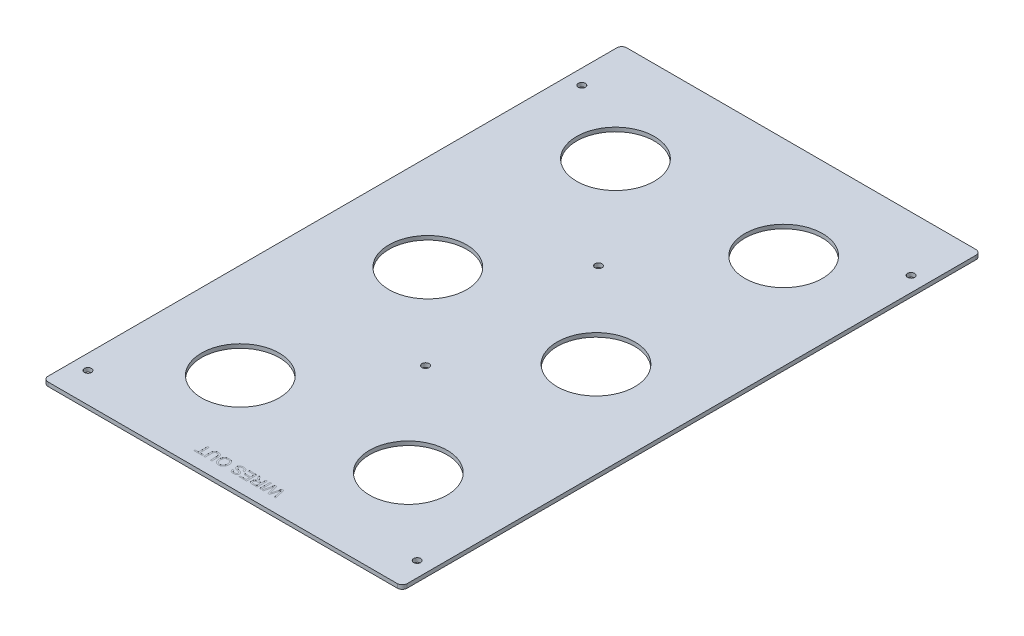
from build123d import *

# Parameters (mm, degrees)
SKETCH1_R             = 24.727
BOSS_EXTRUDE1_DEPTH   = 2.54
SKETCH2_W             = 0.941716851
SKETCH2_H             = 6.677628581
CUT_EXTRUDE2_DEPTH    = 0.0254
F_8_CLEARANCE_HOLE1_D = 4.4958


with BuildPart() as part:
    # Sketch1 → Boss-Extrude1 (new body)
    with BuildSketch(Plane(origin=(0, 0, 0), x_dir=(1, 0, 0), z_dir=(0, 1, 0))):
        with BuildLine():
            Line((-111.125, 184.15), (111.125, 184.15))
            ThreePointArc((111.125, 184.15), (113.37006403, 183.22006403), (114.3, 180.975))
            Line((114.3, 180.975), (114.3, -180.975))
            ThreePointArc((114.3, -180.975), (113.37006403, -183.22006403), (111.125, -184.15))
            Line((111.125, -184.15), (-111.125, -184.15))
            ThreePointArc((-111.125, -184.15), (-113.37006403, -183.22006403), (-114.3, -180.975))
            Line((-114.3, -180.975), (-114.3, 180.975))
            ThreePointArc((-114.3, 180.975), (-113.37006403, 183.22006403), (-111.125, 184.15))
        make_face()
        with Locations((53.5178, -119.508581684)):
            Circle(SKETCH1_R, mode=Mode.SUBTRACT)
        with Locations((53.5178, -0.064290842)):
            Circle(SKETCH1_R, mode=Mode.SUBTRACT)
        with Locations((-53.5178, -119.38)):
            Circle(SKETCH1_R, mode=Mode.SUBTRACT)
        with Locations((-53.5178, -0.064290842)):
            Circle(SKETCH1_R, mode=Mode.SUBTRACT)
        with Locations((-53.5178, 119.38)):
            Circle(SKETCH1_R, mode=Mode.SUBTRACT)
        with Locations((53.5178, 119.38)):
            Circle(SKETCH1_R, mode=Mode.SUBTRACT)
    extrude(amount=BOSS_EXTRUDE1_DEPTH)

    # Sketch2 → Cut-Extrude2 (cut)
    # profile 1 of 8: a face of its own
    with BuildSketch(Plane(origin=(0, 2.54, 0), x_dir=(1, 0, 0), z_dir=(0, 1, 0))):
        with BuildLine():
            Line((23.632943238, -168.91), (25.314389377, -175.587628581))
            Line((25.314389377, -175.587628581), (24.341906208, -175.587628581))
            Line((24.341906208, -175.587628581), (23.350695716, -171.196071163))
            add(Edge.make_bspline(
                [(23.350695716, -171.196071163), (23.299325023, -170.969580808), (23.19710809, -170.518912379), (23.096001693, -170.067993508), (23.045707872, -169.843690855)],
                knots=[0, 0, 0, 0, 1.00513078, 2, 2, 2, 2], degree=3))
            add(Edge.make_bspline(
                [(23.045707872, -169.843690855), (23.021895326, -169.924344538), (22.976941578, -170.076603994), (22.916172822, -170.292446444), (22.860978508, -170.480827734), (22.813955785, -170.642626067), (22.775881668, -170.778068762), (22.743008908, -170.885491505), (22.720603246, -170.966997983), (22.70732561, -171.011932775), (22.701927715, -171.030200581)],
                knots=[0, 0, 0, 0, 1.633809233, 3.084334118, 4.356383392, 5.447555203, 6.357852567, 7.089694452, 7.629924063, 8, 8, 8, 8], degree=3))
            Line((22.701927715, -171.030200581), (21.382989057, -175.587628581))
            Line((21.382989057, -175.587628581), (20.24998597, -175.587628581))
            Line((20.24998597, -175.587628581), (19.296230125, -172.24212596))
            add(Edge.make_bspline(
                [(19.296230125, -172.24212596), (19.243596084, -172.03545393), (19.139813145, -171.627941413), (19.001920759, -171.020936424), (18.874650495, -170.428657498), (18.801340432, -170.036929476), (18.765176731, -169.843690855)],
                knots=[0, 0, 0, 0, 1.04154457, 2.053700482, 3.039894486, 4, 4, 4, 4], degree=3))
            add(Edge.make_bspline(
                [(18.765176731, -169.843690855), (18.742796194, -169.942212876), (18.695517606, -170.150339344), (18.622811501, -170.478808574), (18.540293141, -170.839224554), (18.484149649, -171.09036912), (18.454838223, -171.221486816)],
                knots=[0, 0, 0, 0, 0.858436457, 1.813435672, 2.858437265, 4, 4, 4, 4], degree=3))
            Line((18.454838223, -171.221486816), (17.468978394, -175.587628581))
            Line((17.468978394, -175.587628581), (16.496495226, -175.587628581))
            Line((16.496495226, -175.587628581), (18.179279031, -168.91))
            Line((18.179279031, -168.91), (19.214632501, -168.91))
            Line((19.214632501, -168.91), (20.609818119, -174.01319572))
            add(Edge.make_bspline(
                [(20.609818119, -174.01319572), (20.623827793, -174.063084201), (20.650440955, -174.157853738), (20.685324579, -174.29309308), (20.719917615, -174.412030516), (20.747432964, -174.516203119), (20.771245195, -174.604561153), (20.792331944, -174.676845919), (20.805894374, -174.734472146), (20.815702094, -174.76722518), (20.819831679, -174.781015994)],
                knots=[0, 0, 0, 0, 1.562239628, 2.967673567, 4.210417925, 5.296319877, 6.215971374, 6.969386481, 7.566055473, 8, 8, 8, 8], degree=3))
            add(Edge.make_bspline(
                [(20.819831679, -174.781015994), (20.844657297, -174.693580195), (20.891682413, -174.527957792), (20.960166786, -174.295091919), (21.019046174, -174.090752029), (21.055687775, -173.96458835), (21.072650549, -173.906182442)],
                knots=[0, 0, 0, 0, 1.197732026, 2.268764715, 3.198546125, 4, 4, 4, 4], degree=3))
            Line((21.072650549, -173.906182442), (22.518667475, -168.91))
            Line((22.518667475, -168.91), (23.632943238, -168.91))
        make_face()
    # profile 2 of 8: a face of its own
    with BuildSketch(Plane(origin=(0, 2.54, 0), x_dir=(1, 0, 0), z_dir=(0, 1, 0))):
        with Locations((15.340751818, -172.248814291)):
            Rectangle(SKETCH2_W, SKETCH2_H)
    # profile 3 of 8: a face of its own
    with BuildSketch(Plane(origin=(0, 2.54, 0), x_dir=(1, 0, 0), z_dir=(0, 1, 0))):
        with BuildLine():
            Line((13.328902181, -168.91), (13.328902181, -175.587628581))
            Line((13.328902181, -175.587628581), (10.431517665, -175.587628581))
            add(Edge.make_bspline(
                [(10.431517665, -175.587628581), (10.363292806, -175.587096546), (10.231251578, -175.586066856), (10.03976983, -175.578708935), (9.861463117, -175.563077027), (9.695207674, -175.545618097), (9.541287988, -175.519839646), (9.399630705, -175.489596873), (9.270779114, -175.453853433), (9.153752793, -175.411603204), (9.045169062, -175.363819062), (8.944548789, -175.304828573), (8.847571535, -175.240298913), (8.758103027, -175.163854788), (8.672113635, -175.08172384), (8.593203482, -174.989796624), (8.519037225, -174.890373993), (8.428860855, -174.746400185), (8.334151114, -174.553413553), (8.252576009, -174.308226002), (8.200705014, -174.05148519), (8.195105726, -173.876110271), (8.192264811, -173.787130169)],
                knots=[0, 0, 0, 0, 1.242075696, 2.40389213, 3.487198984, 4.500157661, 5.446319301, 6.326791195, 7.136300648, 7.878370406, 8.590488565, 9.292260633, 9.999224673, 10.708050372, 11.431369221, 12.162165018, 12.910600795, 13.687589445, 15.252257874, 16.810406251, 18.381693487, 20, 20, 20, 20], degree=3))
            add(Edge.make_bspline(
                [(8.192264811, -173.787130169), (8.193571517, -173.730008672), (8.19615235, -173.617189797), (8.215921505, -173.45131567), (8.251692958, -173.292830312), (8.297560289, -173.14034246), (8.360348032, -172.996024572), (8.433051662, -172.856884453), (8.523248176, -172.726910071), (8.623957418, -172.601757556), (8.741064038, -172.487074803), (8.871326311, -172.381080347), (9.018660448, -172.290119283), (9.178234156, -172.205586967), (9.354159906, -172.136163929), (9.54378457, -172.075034695), (9.748575738, -172.02790233), (9.890519546, -172.004161241), (9.963334571, -171.991982422)],
                knots=[0, 0, 0, 0, 0.982645791, 1.940792824, 2.867691729, 3.775150443, 4.675643875, 5.571354211, 6.471357401, 7.392684514, 8.331098131, 9.285922955, 10.275520706, 11.304845665, 12.388884831, 13.524255008, 14.729980297, 16, 16, 16, 16], degree=3))
            add(Edge.make_bspline(
                [(9.963334571, -171.991982422), (9.909404212, -171.965100634), (9.80713011, -171.914121729), (9.667956952, -171.829773388), (9.546035076, -171.750366643), (9.476778417, -171.69082278), (9.44432017, -171.66291659)],
                knots=[0, 0, 0, 0, 1.172551213, 2.223638478, 3.167479604, 4, 4, 4, 4], degree=3))
            add(Edge.make_bspline(
                [(9.44432017, -171.66291659), (9.381132019, -171.601164157), (9.251543527, -171.474520084), (9.074703105, -171.256807636), (8.899721615, -171.017386254), (8.794666383, -170.842915484), (8.740707864, -170.753303723)],
                knots=[0, 0, 0, 0, 0.918170575, 1.883016652, 2.912673989, 4, 4, 4, 4], degree=3))
            Line((8.740707864, -170.753303723), (7.645159425, -168.91))
            Line((7.645159425, -168.91), (8.724655872, -168.91))
            Line((8.724655872, -168.91), (9.556684113, -170.319899945))
            add(Edge.make_bspline(
                [(9.556684113, -170.319899945), (9.586601501, -170.369366751), (9.644576487, -170.465225299), (9.728289267, -170.605242248), (9.810477346, -170.734077121), (9.886334988, -170.85574056), (9.960672974, -170.96702405), (10.027312005, -171.072139162), (10.094234973, -171.165131078), (10.171077393, -171.276850283), (10.264921144, -171.397638948), (10.374430167, -171.52172404), (10.475116427, -171.624510619), (10.602349215, -171.722582681), (10.760556516, -171.812377229), (10.893947832, -171.85497336), (10.958558061, -171.875605481)],
                knots=[0, 0, 0, 0, 1.130591283, 2.190900266, 3.190104209, 4.119071823, 4.994606968, 5.807262858, 6.55236009, 7.234593472, 8.459046683, 9.540234366, 10.471327768, 11.266723835, 12.676093724, 14, 14, 14, 14], degree=3))
            add(Edge.make_bspline(
                [(10.958558061, -171.875605481), (10.985700699, -171.880500221), (11.047668153, -171.891675059), (11.152888735, -171.898973364), (11.28037638, -171.906719538), (11.372768849, -171.90649384), (11.422728157, -171.906371799)],
                knots=[0, 0, 0, 0, 0.709978628, 1.620902492, 2.713552433, 4, 4, 4, 4], degree=3))
            Line((11.422728157, -171.906371799), (12.38718533, -171.906371799))
            Line((12.38718533, -171.906371799), (12.38718533, -168.91))
            Line((12.38718533, -168.91), (13.328902181, -168.91))
        make_face()
        with BuildLine():
            Line((12.38718533, -172.676867405), (10.598725912, -172.676867405))
            add(Edge.make_bspline(
                [(10.598725912, -172.676867405), (10.509041729, -172.678258399), (10.341385561, -172.680858734), (10.10700453, -172.703403287), (9.906514669, -172.738643655), (9.737355011, -172.792167838), (9.595192811, -172.86384728), (9.4719805, -172.951504301), (9.368380463, -173.060253453), (9.28317838, -173.184950494), (9.216573602, -173.320844399), (9.170033561, -173.464671415), (9.138788207, -173.613673587), (9.135593421, -173.715629033), (9.133981662, -173.76706518)],
                knots=[0, 0, 0, 0, 1.546056516, 2.890207646, 4.055830773, 5.050253158, 5.937355789, 6.790906573, 7.644595853, 8.512568064, 9.38593768, 10.244184789, 11.114197691, 12, 12, 12, 12], degree=3))
            add(Edge.make_bspline(
                [(9.133981662, -173.76706518), (9.135218998, -173.804549755), (9.137642576, -173.877971028), (9.150482994, -173.985697904), (9.174913004, -174.087786542), (9.208647521, -174.184972845), (9.251360342, -174.27746782), (9.303847642, -174.364907678), (9.36583859, -174.446845812), (9.436949475, -174.523685608), (9.518568997, -174.593612923), (9.611805656, -174.653942185), (9.715914915, -174.705209834), (9.83102038, -174.745899051), (9.956758704, -174.778443865), (10.093845904, -174.800094864), (10.241654987, -174.815761459), (10.344078112, -174.816667262), (10.396738349, -174.817132975)],
                knots=[0, 0, 0, 0, 0.965235723, 1.89061323, 2.787065514, 3.661873922, 4.534873316, 5.404925039, 6.281839248, 7.175200054, 8.095223355, 9.040740021, 10.02630299, 11.075573487, 12.177989335, 13.364883635, 14.645170704, 16, 16, 16, 16], degree=3))
            Line((10.396738349, -174.817132975), (12.38718533, -174.817132975))
            Line((12.38718533, -174.817132975), (12.38718533, -172.676867405))
        make_face(mode=Mode.SUBTRACT)
    # profile 4 of 8: a face of its own
    with BuildSketch(Plane(origin=(0, 2.54, 0), x_dir=(1, 0, 0), z_dir=(0, 1, 0))):
        Polygon((6.6512736, -168.91), (6.6512736, -175.587628581), (1.942689345, -175.587628581), (1.942689345, -174.817132975), (5.709556749, -174.817132975), (5.709556749, -172.762478027), (2.199521213, -172.762478027), (2.199521213, -171.991982422), (5.709556749, -171.991982422), (5.709556749, -169.680495605), (1.771468099, -169.680495605), (1.771468099, -168.91), align=None)
    # profile 5 of 8: a face of its own
    with BuildSketch(Plane(origin=(0, 2.54, 0), x_dir=(1, 0, 0), z_dir=(0, 1, 0))):
        with BuildLine():
            Line((0.829751248, -171.221486816), (-0.111965603, -171.221486816))
            add(Edge.make_bspline(
                [(-0.111965603, -171.221486816), (-0.122300306, -171.136920767), (-0.142153826, -170.974464831), (-0.198105729, -170.744412505), (-0.268592025, -170.537033889), (-0.361338467, -170.352541821), (-0.475255133, -170.186545829), (-0.617782751, -170.039543528), (-0.788933822, -169.910501137), (-0.984673261, -169.800161916), (-1.198851792, -169.707216884), (-1.429578835, -169.642014332), (-1.673439367, -169.602475454), (-1.840524353, -169.597450703), (-1.925840675, -169.594884983)],
                knots=[0, 0, 0, 0, 1.125761249, 2.162647979, 3.12492346, 4.01623828, 4.884793378, 5.777219259, 6.711258599, 7.709587174, 8.742442187, 9.791331093, 10.872217593, 12, 12, 12, 12], degree=3))
            add(Edge.make_bspline(
                [(-1.925840675, -169.594884983), (-2.00132428, -169.596288662), (-2.148061054, -169.599017353), (-2.361175224, -169.631583172), (-2.561144255, -169.679761442), (-2.745807794, -169.749052862), (-2.911454681, -169.836152826), (-3.058487465, -169.935607161), (-3.180435603, -170.054131077), (-3.279079502, -170.185129954), (-3.35563269, -170.324239119), (-3.409002883, -170.467751543), (-3.444935193, -170.612872597), (-3.448840901, -170.711184835), (-3.450779894, -170.759992053)],
                knots=[0, 0, 0, 0, 1.267544124, 2.464049433, 3.614542348, 4.719673496, 5.768837234, 6.754183997, 7.692231426, 8.612479311, 9.501217876, 10.350240008, 11.180974857, 12, 12, 12, 12], degree=3))
            add(Edge.make_bspline(
                [(-3.450779894, -170.759992053), (-3.448734217, -170.808320403), (-3.444731839, -170.90287513), (-3.41298182, -171.039749764), (-3.361676939, -171.167107787), (-3.289708786, -171.286035669), (-3.191897669, -171.39581424), (-3.065416139, -171.493264907), (-2.913787566, -171.585956174), (-2.799626619, -171.635388546), (-2.739141591, -171.661578924)],
                knots=[0, 0, 0, 0, 0.942081658, 1.843188798, 2.725198023, 3.611401405, 4.541884661, 5.575766242, 6.715586633, 8, 8, 8, 8], degree=3))
            add(Edge.make_bspline(
                [(-2.739141591, -171.661578924), (-2.715616019, -171.671233178), (-2.662467478, -171.693043891), (-2.571372485, -171.721914532), (-2.463281361, -171.75926362), (-2.335982467, -171.797529049), (-2.189343903, -171.83852873), (-2.02471077, -171.885712807), (-1.840776969, -171.934847595), (-1.643984004, -171.986863987), (-1.444785638, -172.039623623), (-1.254502177, -172.093569336), (-1.078352587, -172.144734389), (-0.917007378, -172.197320494), (-0.770312038, -172.249221233), (-0.637865794, -172.300101227), (-0.519433039, -172.34869434), (-0.447100591, -172.384431007), (-0.412940449, -172.401308212)],
                knots=[0, 0, 0, 0, 0.499208779, 1.12780332, 1.87546358, 2.745246929, 3.737578632, 4.865834649, 6.108484299, 7.476352792, 8.863398792, 10.155242256, 11.360521946, 12.465428895, 13.487415091, 14.415997097, 15.251929613, 16, 16, 16, 16], degree=3))
            add(Edge.make_bspline(
                [(-0.412940449, -172.401308212), (-0.33439709, -172.443817677), (-0.182787966, -172.525872006), (0.022051427, -172.671714273), (0.19175084, -172.836704186), (0.331696087, -173.014473096), (0.439742994, -173.205942272), (0.516080243, -173.409014609), (0.565656107, -173.622897826), (0.570471317, -173.769909024), (0.572919379, -173.844649807)],
                knots=[0, 0, 0, 0, 1.158956011, 2.237086722, 3.252429106, 4.221720014, 5.165272549, 6.094237939, 7.031106807, 8, 8, 8, 8], degree=3))
            add(Edge.make_bspline(
                [(0.572919379, -173.844649807), (0.5697455, -173.927437968), (0.563432677, -174.092103021), (0.507294577, -174.333691375), (0.417883054, -174.56692136), (0.314888491, -174.751512006), (0.215916434, -174.891668806), (0.132735448, -174.991049213), (0.04094839, -175.083472006), (-0.057437483, -175.170854779), (-0.165974497, -175.249930177), (-0.281411584, -175.323343203), (-0.406113443, -175.38912905), (-0.582665272, -175.469334226), (-0.817493636, -175.551565656), (-1.113162554, -175.622810202), (-1.424366052, -175.664515975), (-1.636779572, -175.670290332), (-1.745255767, -175.673239204)],
                knots=[0, 0, 0, 0, 1.200056028, 2.386902731, 3.579012093, 4.815906327, 5.442508847, 6.067203999, 6.694073756, 7.331409728, 7.974631341, 8.640655778, 9.315145047, 10.018831381, 11.453504181, 12.917815188, 14.425977399, 16, 16, 16, 16], degree=3))
            add(Edge.make_bspline(
                [(-1.745255767, -175.673239204), (-1.864008344, -175.670604036), (-2.094800286, -175.665482671), (-2.430387838, -175.620316752), (-2.744325301, -175.547538362), (-2.990076794, -175.461794803), (-3.172239093, -175.376566745), (-3.300639933, -175.307887436), (-3.420230957, -175.230485202), (-3.533294276, -175.14853061), (-3.635789241, -175.056685259), (-3.731948999, -174.959779443), (-3.820155827, -174.855945122), (-3.924903958, -174.707643741), (-4.03554884, -174.509311317), (-4.135470952, -174.254928517), (-4.199457348, -173.984452318), (-4.213925457, -173.798607284), (-4.221275499, -173.704194878)],
                knots=[0, 0, 0, 0, 1.607451709, 3.124032445, 4.575401297, 5.965664223, 6.638286369, 7.297495781, 7.935629741, 8.566004073, 9.186263309, 9.796807256, 10.413736732, 11.028594479, 12.253110936, 13.478624344, 14.719098735, 16, 16, 16, 16], degree=3))
            Line((-4.221275499, -173.704194878), (-3.279558648, -173.704194878))
            add(Edge.make_bspline(
                [(-3.279558648, -173.704194878), (-3.273771602, -173.752058718), (-3.262436422, -173.845810392), (-3.230636994, -173.980547909), (-3.192600267, -174.10710359), (-3.144232188, -174.224055068), (-3.086506247, -174.332436506), (-3.018033712, -174.431011758), (-2.94152464, -174.521646465), (-2.85513315, -174.602750037), (-2.758041884, -174.673975704), (-2.650230509, -174.735532482), (-2.532098757, -174.788145122), (-2.402500751, -174.828705316), (-2.26316937, -174.862387332), (-2.112501629, -174.886565121), (-1.951024251, -174.899089809), (-1.839803256, -174.901504216), (-1.782710414, -174.902743598)],
                knots=[0, 0, 0, 0, 1.074256797, 2.104164074, 3.082231143, 4.018364317, 4.921387537, 5.814946689, 6.689553043, 7.561782592, 8.450683137, 9.368204304, 10.325224224, 11.328240899, 12.391723181, 13.519579538, 14.726730929, 16, 16, 16, 16], degree=3))
            add(Edge.make_bspline(
                [(-1.782710414, -174.902743598), (-1.723364228, -174.902302171), (-1.608484606, -174.901447678), (-1.442447663, -174.885584388), (-1.288428272, -174.864200282), (-1.147375889, -174.8313749), (-1.017974289, -174.79275508), (-0.902493225, -174.740895859), (-0.798180298, -174.682436669), (-0.706937899, -174.61391263), (-0.62829401, -174.537943815), (-0.557710091, -174.459906863), (-0.500797494, -174.375719234), (-0.450683023, -174.290042614), (-0.415765366, -174.198320253), (-0.388355797, -174.104542703), (-0.371689275, -174.006649151), (-0.369774726, -173.940134121), (-0.368797472, -173.906182442)],
                knots=[0, 0, 0, 0, 1.464224776, 2.834379057, 4.11387117, 5.299348816, 6.406355048, 7.441191667, 8.417293255, 9.352838038, 10.248153785, 11.113750317, 11.944205591, 12.75240885, 13.557683963, 14.358962649, 15.162355132, 16, 16, 16, 16], degree=3))
            add(Edge.make_bspline(
                [(-0.368797472, -173.906182442), (-0.37123109, -173.848731061), (-0.375954518, -173.737223227), (-0.424187626, -173.578804208), (-0.498370483, -173.434395009), (-0.571452417, -173.3558227), (-0.608239683, -173.316271744)],
                knots=[0, 0, 0, 0, 1.050964922, 2.039826012, 3.013306874, 4, 4, 4, 4], degree=3))
            add(Edge.make_bspline(
                [(-0.608239683, -173.316271744), (-0.631429982, -173.296506065), (-0.682713897, -173.252795485), (-0.778135549, -173.194949737), (-0.89644413, -173.136503535), (-1.038430802, -173.078405591), (-1.203848303, -173.019938836), (-1.392443217, -172.959783733), (-1.605290389, -172.899729949), (-1.835341443, -172.842797028), (-2.06742145, -172.784340103), (-2.287668031, -172.726739864), (-2.490671798, -172.672911415), (-2.674095348, -172.616871264), (-2.840956873, -172.567716205), (-2.987948727, -172.515816054), (-3.11771171, -172.468717275), (-3.19717772, -172.435472738), (-3.234078005, -172.420035536)],
                knots=[0, 0, 0, 0, 0.523895407, 1.158562347, 1.913798076, 2.79478753, 3.797549825, 4.933675542, 6.202127117, 7.604032848, 9.013379355, 10.32225155, 11.523321485, 12.628397413, 13.623935419, 14.51727859, 15.311493772, 16, 16, 16, 16], degree=3))
            add(Edge.make_bspline(
                [(-3.234078005, -172.420035536), (-3.282099123, -172.397911246), (-3.376356532, -172.354484974), (-3.509729216, -172.280126565), (-3.634989015, -172.203572345), (-3.748235425, -172.119213657), (-3.855033152, -172.034742137), (-3.949935026, -171.943421237), (-4.03498244, -171.847399774), (-4.135724875, -171.715469781), (-4.239063497, -171.53739795), (-4.32785, -171.307252493), (-4.383388253, -171.061361326), (-4.389423008, -170.891824444), (-4.392496745, -170.805472696)],
                knots=[0, 0, 0, 0, 0.899363591, 1.76530001, 2.59691609, 3.395188894, 4.166615117, 4.912545108, 5.632755751, 6.347510175, 7.734752518, 9.118421309, 10.532299558, 12, 12, 12, 12], degree=3))
            add(Edge.make_bspline(
                [(-4.392496745, -170.805472696), (-4.38895673, -170.718216064), (-4.381910949, -170.544547011), (-4.323029718, -170.288939319), (-4.228552762, -170.041766988), (-4.119204846, -169.845674821), (-4.015428246, -169.695673965), (-3.928279472, -169.587851279), (-3.831628839, -169.488155207), (-3.727864782, -169.393458837), (-3.616178846, -169.30569683), (-3.495631673, -169.224832572), (-3.367489359, -169.150049501), (-3.184530779, -169.058819838), (-2.941241491, -168.964081688), (-2.632292045, -168.881909663), (-2.305506818, -168.833218795), (-2.081621479, -168.827373774), (-1.96730832, -168.824389377)],
                knots=[0, 0, 0, 0, 1.196987384, 2.382393894, 3.582009067, 4.820735309, 5.454243406, 6.085350439, 6.72189866, 7.359035515, 8.013098289, 8.67027723, 9.350744424, 10.048966745, 11.475869723, 12.9268444, 14.430883741, 16, 16, 16, 16], degree=3))
            add(Edge.make_bspline(
                [(-1.96730832, -168.824389377), (-1.894611976, -168.825066361), (-1.751765216, -168.82639662), (-1.542326645, -168.839585244), (-1.342192809, -168.863413354), (-1.150563024, -168.89099369), (-0.968341294, -168.932446252), (-0.794482035, -168.979218191), (-0.63057113, -169.037895171), (-0.474803619, -169.102452696), (-0.328605544, -169.178733963), (-0.188907253, -169.260489596), (-0.059089327, -169.354273292), (0.064694543, -169.453730246), (0.178709516, -169.564374285), (0.284274783, -169.683623433), (0.382537737, -169.811206702), (0.471756298, -169.94726202), (0.551403598, -170.090229329), (0.623106063, -170.237623704), (0.683111758, -170.390231372), (0.732561435, -170.547693563), (0.773039531, -170.709295471), (0.801901647, -170.876113556), (0.822853734, -171.04710129), (0.827438496, -171.163014962), (0.829751248, -171.221486816)],
                knots=[0, 0, 0, 0, 1.259929758, 2.475735005, 3.634725603, 4.752877801, 5.82919746, 6.871690464, 7.871395985, 8.84458164, 9.791640072, 10.727373556, 11.647336026, 12.564665335, 13.477425593, 14.397128332, 15.323044476, 16.266184727, 17.214251675, 18.157898412, 19.105082968, 20.053433368, 21.01687335, 21.990151059, 22.98614553, 24, 24, 24, 24], degree=3))
        make_face()
    # profile 6 of 8: a face of its own
    with BuildSketch(Plane(origin=(0, 2.54, 0), x_dir=(1, 0, 0), z_dir=(0, 1, 0))):
        with BuildLine():
            add(Edge.make_bspline(
                [(-7.902532281, -172.160528336), (-7.904868823, -172.294404113), (-7.909421457, -172.555254276), (-7.95145786, -172.935167661), (-8.020805874, -173.292189836), (-8.116201245, -173.627972316), (-8.243080235, -173.939982669), (-8.393628601, -174.232057602), (-8.576292795, -174.499113512), (-8.782691478, -174.744238191), (-9.013292565, -174.960926501), (-9.258801186, -175.153382006), (-9.5223022, -175.313911345), (-9.801356042, -175.446456), (-10.097149626, -175.54821986), (-10.408852094, -175.619463844), (-10.73613018, -175.665423132), (-10.959832408, -175.670596003), (-11.074138323, -175.673239204)],
                knots=[0, 0, 0, 0, 1.203593535, 2.345140965, 3.431924157, 4.471254512, 5.478692091, 6.45615896, 7.42038538, 8.382007041, 9.33218277, 10.260966195, 11.182476517, 12.100814648, 13.034113903, 13.98924309, 14.972556454, 16, 16, 16, 16], degree=3))
            add(Edge.make_bspline(
                [(-11.074138323, -175.673239204), (-11.149533304, -175.671934631), (-11.2992541, -175.669343985), (-11.521000104, -175.649238618), (-11.736781479, -175.614330091), (-11.946724691, -175.565766742), (-12.151139417, -175.504669011), (-12.349890712, -175.429209665), (-12.543296166, -175.340933857), (-12.72962409, -175.238335871), (-12.907551192, -175.122886619), (-13.076351255, -174.997786024), (-13.233401839, -174.860524933), (-13.379460856, -174.712925043), (-13.515657342, -174.555062251), (-13.637638745, -174.383988246), (-13.752624989, -174.205105922), (-13.853438417, -174.014308827), (-13.944828148, -173.81598128), (-14.021432258, -173.609263699), (-14.089271715, -173.397118639), (-14.144048276, -173.178228466), (-14.184879158, -172.951968662), (-14.216276445, -172.719965089), (-14.233230262, -172.480928323), (-14.236209714, -172.319734193), (-14.23771837, -172.238112963)],
                knots=[0, 0, 0, 0, 1.034176269, 2.053687022, 3.051235935, 4.030520976, 5.007759882, 5.975670013, 6.944584641, 7.921900115, 8.890679583, 9.85222947, 10.801660264, 11.7488817, 12.698942795, 13.658174729, 14.62880618, 15.613957309, 16.61577279, 17.622338666, 18.636016077, 19.670029534, 20.714984856, 21.788550191, 22.880224384, 24, 24, 24, 24], degree=3))
            add(Edge.make_bspline(
                [(-14.23771837, -172.238112963), (-14.23632704, -172.155147409), (-14.233578228, -171.991234652), (-14.214978638, -171.749085358), (-14.182274095, -171.513887669), (-14.138897087, -171.284940267), (-14.08077322, -171.062719774), (-14.011701935, -170.846589067), (-13.928156318, -170.637835469), (-13.833800806, -170.435955826), (-13.727037631, -170.243726737), (-13.609270434, -170.062492165), (-13.480416558, -169.893948118), (-13.342430464, -169.736024416), (-13.192553381, -169.591989944), (-13.031942973, -169.459700845), (-12.860927681, -169.339726304), (-12.680177856, -169.23135865), (-12.492581258, -169.136071154), (-12.300415691, -169.051863457), (-12.103454523, -168.983732216), (-11.904579332, -168.923302758), (-11.700828725, -168.879850893), (-11.494123972, -168.847472249), (-11.283166388, -168.828538825), (-11.141503927, -168.825779634), (-11.070125326, -168.824389377)],
                knots=[0, 0, 0, 0, 1.141458971, 2.255149016, 3.338763392, 4.407145747, 5.45911027, 6.497028761, 7.526847988, 8.550472592, 9.561035647, 10.549629976, 11.521388012, 12.477647518, 13.432134385, 14.377847498, 15.337760086, 16.303574593, 17.274809663, 18.230970776, 19.187525402, 20.140611526, 21.088808525, 22.051011914, 23.017975238, 24, 24, 24, 24], degree=3))
            add(Edge.make_bspline(
                [(-11.070125326, -168.824389377), (-10.993387527, -168.825578265), (-10.841389166, -168.827933154), (-10.616494071, -168.849614076), (-10.397937614, -168.88672926), (-10.184469546, -168.93331902), (-9.978465382, -168.998729636), (-9.778201489, -169.075799462), (-9.585162533, -169.169065442), (-9.398356806, -169.274423347), (-9.219457707, -169.39122805), (-9.052258186, -169.52060398), (-8.894291212, -169.6580082), (-8.750367804, -169.808767929), (-8.616177575, -169.968166885), (-8.492171182, -170.137588378), (-8.380100815, -170.317881087), (-8.280587519, -170.508080587), (-8.190852932, -170.703360022), (-8.115208666, -170.90361748), (-8.048743226, -171.105945631), (-7.995807462, -171.311579843), (-7.953624841, -171.520048878), (-7.92525991, -171.731005018), (-7.90477459, -171.944762669), (-7.903283479, -172.088244511), (-7.902532281, -172.160528336)],
                knots=[0, 0, 0, 0, 1.072846099, 2.125039441, 3.155166917, 4.171599398, 5.177324298, 6.174217088, 7.169783185, 8.172042761, 9.17156421, 10.154239632, 11.126115549, 12.096189878, 13.065322046, 14.038037562, 15.029377678, 16.03062832, 17.03785952, 18.032507603, 19.022297599, 20.014323703, 20.999862951, 21.994471951, 22.989647507, 24, 24, 24, 24], degree=3))
        make_face()
        with BuildLine():
            add(Edge.make_bspline(
                [(-8.844249132, -172.149827008), (-8.845691451, -172.053420401), (-8.848503871, -171.865434323), (-8.880709052, -171.591367712), (-8.929517803, -171.332745434), (-8.996992393, -171.088962695), (-9.0870792, -170.861811602), (-9.197220938, -170.650855955), (-9.32641992, -170.455098662), (-9.474608164, -170.276758173), (-9.637434381, -170.116495336), (-9.811433573, -169.976453044), (-9.996444093, -169.859676631), (-10.190016428, -169.762138022), (-10.394717097, -169.686984881), (-10.609565389, -169.633858343), (-10.83455709, -169.60069725), (-10.98796563, -169.596846543), (-11.066112328, -169.594884983)],
                knots=[0, 0, 0, 0, 1.215616022, 2.370365452, 3.475740397, 4.533490648, 5.5560781, 6.552384115, 7.530550651, 8.509299237, 9.471863928, 10.40830403, 11.321168121, 12.226759389, 13.137923578, 14.065605683, 15.014614662, 16, 16, 16, 16], degree=3))
            add(Edge.make_bspline(
                [(-11.066112328, -169.594884983), (-11.145584318, -169.59687414), (-11.301190252, -169.600768903), (-11.529564036, -169.633370577), (-11.746544715, -169.688873529), (-11.954282865, -169.762760558), (-12.149023112, -169.862643127), (-12.335318626, -169.979605429), (-12.508095682, -170.122528616), (-12.671577088, -170.283079607), (-12.818263713, -170.465554814), (-12.948207868, -170.665555052), (-13.054493607, -170.8855657), (-13.143154965, -171.12242268), (-13.21270247, -171.377612405), (-13.261322688, -171.651132636), (-13.291306379, -171.942262372), (-13.294408799, -172.142171822), (-13.296001519, -172.244801292)],
                knots=[0, 0, 0, 0, 0.976909331, 1.912785716, 2.828990727, 3.727421029, 4.617481149, 5.514840137, 6.426786422, 7.368873452, 8.327895072, 9.299698503, 10.295216142, 11.325792517, 12.405818789, 13.542541501, 14.738390493, 16, 16, 16, 16], degree=3))
            add(Edge.make_bspline(
                [(-13.296001519, -172.244801292), (-13.295432936, -172.310823356), (-13.294317582, -172.440334751), (-13.279546538, -172.631236025), (-13.260493814, -172.816199196), (-13.231485645, -172.994985502), (-13.191509057, -173.166854888), (-13.147220595, -173.333114569), (-13.091843858, -173.492336242), (-13.028995551, -173.645128244), (-12.958725969, -173.790764274), (-12.879266751, -173.927807016), (-12.79230587, -174.056711184), (-12.69694247, -174.17690135), (-12.595587364, -174.290074697), (-12.48501404, -174.393289023), (-12.367044024, -174.488597735), (-12.241662552, -174.575025805), (-12.110881776, -174.652718043), (-11.975365427, -174.719721399), (-11.835545168, -174.776527398), (-11.691564755, -174.821039592), (-11.544290507, -174.857788881), (-11.393367263, -174.885010337), (-11.237612443, -174.899281733), (-11.132575308, -174.901581356), (-11.079488987, -174.902743598)],
                knots=[0, 0, 0, 0, 1.220320263, 2.393826742, 3.538159925, 4.657606474, 5.739544833, 6.799495376, 7.837090465, 8.853610905, 9.852768056, 10.824163015, 11.779900663, 12.724912201, 13.658747054, 14.586045767, 15.518168864, 16.460299482, 17.399069918, 18.328125852, 19.252745725, 20.186143833, 21.111865538, 22.057883325, 23.018444021, 24, 24, 24, 24], degree=3))
            add(Edge.make_bspline(
                [(-11.079488987, -174.902743598), (-11.004461348, -174.901228359), (-10.855981652, -174.8982297), (-10.63802316, -174.865825669), (-10.427655857, -174.817041995), (-10.226347354, -174.746576448), (-10.031803252, -174.658111997), (-9.846262357, -174.547970392), (-9.668543877, -174.418461794), (-9.499403075, -174.270137272), (-9.341758209, -174.09901986), (-9.208411133, -173.897407891), (-9.096043603, -173.669968126), (-9.002212749, -173.417318896), (-8.930671151, -173.137491444), (-8.881226496, -172.831693578), (-8.850008279, -172.499601999), (-8.846217925, -172.269399341), (-8.844249132, -172.149827008)],
                knots=[0, 0, 0, 0, 0.895098135, 1.771399171, 2.624879489, 3.470001555, 4.31324378, 5.172350046, 6.041214072, 6.935108351, 7.854676913, 8.809932058, 9.809814619, 10.877726151, 12.02168834, 13.252153056, 14.572707754, 16, 16, 16, 16], degree=3))
        make_face(mode=Mode.SUBTRACT)
    # profile 7 of 8: a face of its own
    with BuildSketch(Plane(origin=(0, 2.54, 0), x_dir=(1, 0, 0), z_dir=(0, 1, 0))):
        with BuildLine():
            Line((-19.631187609, -175.587628581), (-20.57290446, -175.587628581))
            Line((-20.57290446, -175.587628581), (-20.57290446, -171.745851881))
            add(Edge.make_bspline(
                [(-20.57290446, -171.745851881), (-20.57192501, -171.664247803), (-20.570019001, -171.505446134), (-20.561299934, -171.273844826), (-20.54415202, -171.055138552), (-20.518473348, -170.850000395), (-20.487784822, -170.657160187), (-20.451529682, -170.477269216), (-20.405329106, -170.31048789), (-20.353471363, -170.154985437), (-20.291719256, -170.009391707), (-20.218696545, -169.871618347), (-20.134771499, -169.740800183), (-20.038997968, -169.617225143), (-19.932898092, -169.500142704), (-19.815223272, -169.390478973), (-19.68544541, -169.288992677), (-19.546855025, -169.191847255), (-19.395802439, -169.104969249), (-19.232620143, -169.030031887), (-19.058355179, -168.965574542), (-18.872159021, -168.913754817), (-18.674886182, -168.87415287), (-18.46682239, -168.844540645), (-18.247453126, -168.827036747), (-18.097362537, -168.825284902), (-18.020637767, -168.824389377)],
                knots=[0, 0, 0, 0, 1.311377147, 2.551942077, 3.723550895, 4.835332178, 5.873100029, 6.860965504, 7.782222652, 8.65229484, 9.493385443, 10.320318369, 11.155067733, 11.987723446, 12.829729107, 13.691560723, 14.568860379, 15.475173283, 16.409214366, 17.364531151, 18.357450607, 19.391849073, 20.466818896, 21.588529868, 22.767281177, 24, 24, 24, 24], degree=3))
            add(Edge.make_bspline(
                [(-18.020637767, -168.824389377), (-17.945707184, -168.825492015), (-17.799710789, -168.827640419), (-17.585767701, -168.842176993), (-17.382254078, -168.867912541), (-17.188586558, -168.901766855), (-17.005718965, -168.947263096), (-16.833869804, -169.003868508), (-16.671919216, -169.069157223), (-16.519670433, -169.143700079), (-16.379396063, -169.230427823), (-16.24748194, -169.323051281), (-16.127830338, -169.427424286), (-16.018137536, -169.539614763), (-15.918239724, -169.660544816), (-15.83009427, -169.79136773), (-15.750285309, -169.930207297), (-15.684045049, -170.080651617), (-15.62424082, -170.24122443), (-15.574119498, -170.415302144), (-15.531322211, -170.602884958), (-15.497280422, -170.804405986), (-15.468391974, -171.019786753), (-15.4511903, -171.24981222), (-15.438263826, -171.493332251), (-15.436944188, -171.660221793), (-15.43626709, -171.745851881)],
                knots=[0, 0, 0, 0, 1.193078897, 2.324621146, 3.412165798, 4.458033356, 5.453301711, 6.409727336, 7.336550967, 8.231923267, 9.10494906, 9.959977801, 10.795507141, 11.62892236, 12.456145611, 13.289107106, 14.138012467, 15.002334476, 15.903094886, 16.864671381, 17.884255983, 18.965082669, 20.117808422, 21.342986352, 22.636701193, 24, 24, 24, 24], degree=3))
            Line((-15.43626709, -171.745851881), (-15.43626709, -175.587628581))
            Line((-15.43626709, -175.587628581), (-16.377983941, -175.587628581))
            Line((-16.377983941, -175.587628581), (-16.377983941, -171.789994859))
            add(Edge.make_bspline(
                [(-16.377983941, -171.789994859), (-16.378599989, -171.720878857), (-16.379788662, -171.587518513), (-16.385973544, -171.394329382), (-16.398394308, -171.215057108), (-16.413559277, -171.049840836), (-16.434880425, -170.898922017), (-16.461682215, -170.762391193), (-16.491970659, -170.639457766), (-16.537132914, -170.495572257), (-16.613199955, -170.335582907), (-16.728413961, -170.16286909), (-16.876113894, -170.017836074), (-17.047245029, -169.894823308), (-17.242803501, -169.798882357), (-17.459346341, -169.729045107), (-17.69665151, -169.687224186), (-17.861727698, -169.682788629), (-17.947066138, -169.680495605)],
                knots=[0, 0, 0, 0, 1.090438201, 2.104016592, 3.048763244, 3.925116223, 4.720979001, 5.45216101, 6.119252661, 6.717681473, 7.82855347, 8.901677854, 9.976092604, 11.075141713, 12.213970494, 13.397440122, 14.654570346, 16, 16, 16, 16], degree=3))
            add(Edge.make_bspline(
                [(-17.947066138, -169.680495605), (-18.020230425, -169.681739968), (-18.161503258, -169.684142707), (-18.365209886, -169.703554154), (-18.551977222, -169.738859127), (-18.723679921, -169.784712746), (-18.87893292, -169.846197227), (-19.018851259, -169.92065566), (-19.139734436, -170.012153114), (-19.249111741, -170.114862262), (-19.341476202, -170.2398953), (-19.418659774, -170.388483569), (-19.485224023, -170.560749715), (-19.53973443, -170.75833113), (-19.579542333, -170.981466532), (-19.610641149, -171.228761079), (-19.626952591, -171.501288824), (-19.629735298, -171.690989177), (-19.631187609, -171.789994859)],
                knots=[0, 0, 0, 0, 1.111591514, 2.146370713, 3.104407205, 3.996889121, 4.842307775, 5.6365848, 6.396727704, 7.139400744, 7.909024799, 8.745519786, 9.676513234, 10.710427131, 11.854494362, 13.117490512, 14.495602074, 16, 16, 16, 16], degree=3))
            Line((-19.631187609, -171.789994859), (-19.631187609, -175.587628581))
        make_face()
    # profile 8 of 8: a face of its own
    with BuildSketch(Plane(origin=(0, 2.54, 0), x_dir=(1, 0, 0), z_dir=(0, 1, 0))):
        Polygon((-23.740497504, -168.91), (-23.740497504, -174.817132975), (-21.600231934, -174.817132975), (-21.600231934, -175.587628581), (-26.822479926, -175.587628581), (-26.822479926, -174.817132975), (-24.682214355, -174.817132975), (-24.682214355, -168.91), align=None)
    extrude(amount=-CUT_EXTRUDE2_DEPTH, mode=Mode.SUBTRACT)

    # #8 Clearance Hole1 (through all)
    with Locations(Plane(origin=(0, 0, 0), x_dir=(-1, 0, 0), z_dir=(0, -1, 0))):
        with Locations((104.775, -165.1), (-104.775, -165.1), (-104.775, 149.225), (104.775, 149.225), (0, -55.033333333), (0, 55.033333333)):
            Hole(F_8_CLEARANCE_HOLE1_D / 2)


solid = part.part
